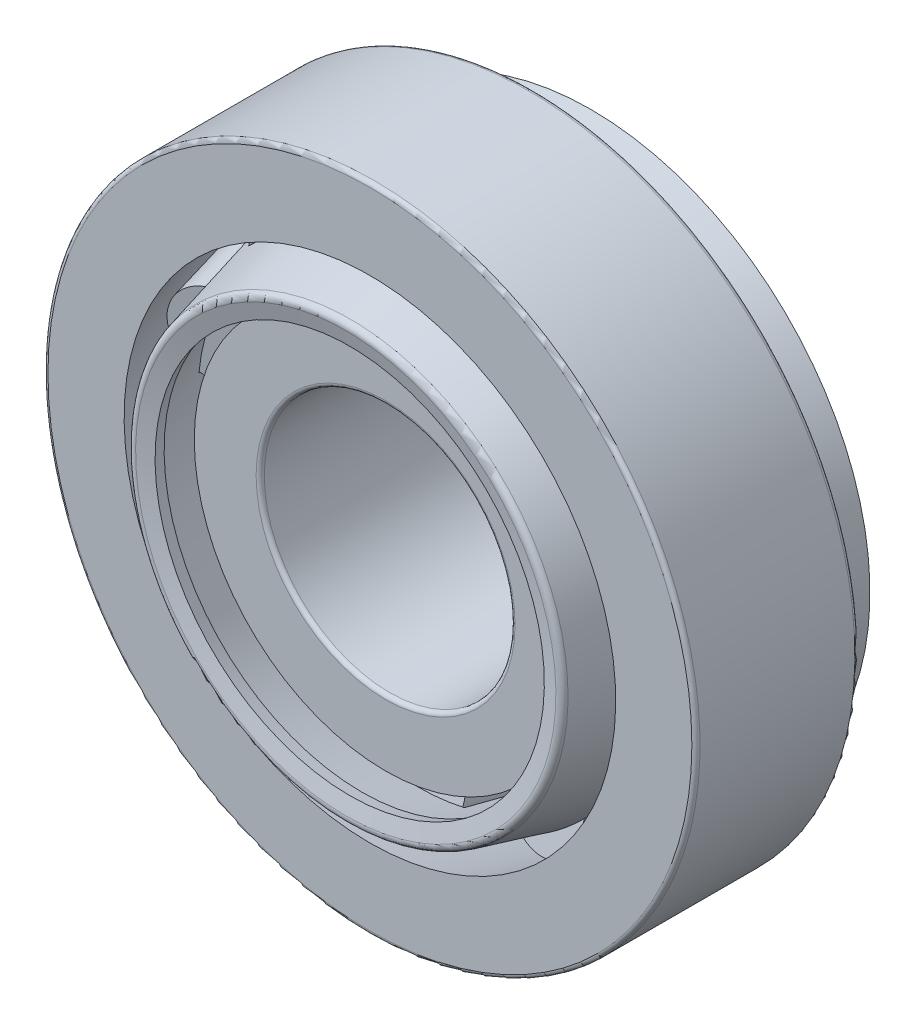
from build123d import *

# Parameters (mm, degrees)
SKETCH8_R           = 3.554681599
CUT_EXTRUDE1_DEPTH  = 9.171791
SKETCH10_R          = 3.427681599
BOSS_EXTRUDE1_DEPTH = 9.171791
CIRPATTERN1_COUNT   = 10
CIRPATTERN2_COUNT   = 10
FILLET1_R           = 0.325
FILLET2_R           = 0.325


with BuildPart() as part:
    # Sketch1 → Revolve1 (revolve)
    with BuildSketch(Plane(origin=(0, 0, 0), x_dir=(0, 0, -1), z_dir=(1, 0, 0)), mode=Mode.PRIVATE) as revolve1_sk:
        Polygon((-6.5, 26), (6.5, 26), (6.5, 22.908826187), (-6.5, 19.6), align=None)
    revolve(revolve1_sk.sketch.rotate(Axis((0, 0, 5.25), (0, 0, -1)), 180), axis=Axis((0, 0, 5.25), (0, 0, -1)))

    # Fillet1
    fillet1_edges = [part.edges().sort_by_distance(p)[0] for p in [
        (0, 26, -6.5),
        (0, 26, 6.5),
    ]]
    fillet(fillet1_edges, radius=FILLET1_R)


with BuildPart() as body_2:
    # Sketch5 → Revolve4 (revolve)
    with BuildSketch(Plane(origin=(0, 0, 0), x_dir=(0, 0, -1), z_dir=(1, 0, 0)), mode=Mode.PRIVATE) as revolve4_sk:
        Polygon((7.37680042, 15.79596116), (-1.51159979, 13.533640285), (-1.95, 15.256064615), (-5.25, 15.256064615), (-5.25, 10), (9.75, 10), (9.75, 17.51838549), (6.93840021, 17.51838549), align=None)
    revolve(revolve4_sk.sketch.rotate(Axis((0, 0, 5.25), (0, 0, -1)), 180), axis=Axis((0, 0, 5.25), (0, 0, -1)))

    # Fillet2
    fillet2_edges = [body_2.edges().sort_by_distance(p)[0] for p in [
        (0, 10, -9.75),
        (0, 10, 5.25),
    ]]
    fillet(fillet2_edges, radius=FILLET2_R)


with BuildPart() as body_3:
    # Sketch2 → Revolve2 (revolve)
    with BuildSketch(Plane(origin=(0, 0, 0), x_dir=(0, 0, -1), z_dir=(1, 0, 0)), mode=Mode.PRIVATE) as revolve2_sk:
        with BuildLine():
            Line((-8.426669626, 16.759664434), (-8.11159979, 15.521791049))
            Line((-8.11159979, 15.521791049), (-7.142497899, 15.768451797))
            Line((-7.142497899, 15.768451797), (-7.334237361, 16.521774235))
            Line((-7.334237361, 16.521774235), (11.369860328, 21.282436408))
            Line((11.369860328, 21.282436408), (11.12319958, 22.251538299))
            Line((11.12319958, 22.251538299), (-8.065449054, 17.367545753))
            ThreePointArc((-8.065449054, 17.367545753), (-8.371955684, 17.138416323), (-8.426669626, 16.759664434))
        make_face()
    revolve(revolve2_sk.sketch.rotate(Axis((0, 0, 5.25), (0, 0, -1)), 180), axis=Axis((0, 0, 5.25), (0, 0, -1)))

    # Sketch8 → Cut-Extrude1 (cut)
    with BuildSketch(Plane(origin=(0, 16.978488945, 2.38840021), x_dir=(1, 0, 0), z_dir=(0, -0.2466607473812321, 0.9691018912897301))):
        Circle(SKETCH8_R)
    cut_extrude1 = extrude(amount=-CUT_EXTRUDE1_DEPTH, mode=Mode.SUBTRACT)

    # CirPattern1: Cut-Extrude1 ×10 about axis
    cirpattern1_axis = Axis((0, 0, 0), (0, 0, 1))
    for i in range(1, CIRPATTERN1_COUNT):
        add(cut_extrude1.rotate(cirpattern1_axis, i * 360 / CIRPATTERN1_COUNT), mode=Mode.SUBTRACT)


with BuildPart() as body_4:
    # Sketch10 → Boss-Extrude1 (new body)
    with BuildSketch(Plane(origin=(0, 16.978488945, 2.38840021), x_dir=(1, 0, 0), z_dir=(0, -0.2466607473812321, 0.9691018912897301))):
        with Locations(Location((0, 0, 0), (0, 0, 270))):
            Circle(SKETCH10_R)
    extrude(amount=-BOSS_EXTRUDE1_DEPTH)


with BuildPart() as cirpattern2_1:
    # CirPattern2: pattern copy
    add(body_4.part.rotate(Axis((0, 0, 0), (0, 0, 1)), 1 * 360 / CIRPATTERN2_COUNT))


with BuildPart() as cirpattern2_2:
    # CirPattern2: pattern copy
    add(body_4.part.rotate(Axis((0, 0, 0), (0, 0, 1)), 2 * 360 / CIRPATTERN2_COUNT))


with BuildPart() as cirpattern2_3:
    # CirPattern2: pattern copy
    add(body_4.part.rotate(Axis((0, 0, 0), (0, 0, 1)), 3 * 360 / CIRPATTERN2_COUNT))


with BuildPart() as cirpattern2_4:
    # CirPattern2: pattern copy
    add(body_4.part.rotate(Axis((0, 0, 0), (0, 0, 1)), 4 * 360 / CIRPATTERN2_COUNT))


with BuildPart() as cirpattern2_5:
    # CirPattern2: pattern copy
    add(body_4.part.rotate(Axis((0, 0, 0), (0, 0, 1)), 5 * 360 / CIRPATTERN2_COUNT))


with BuildPart() as cirpattern2_6:
    # CirPattern2: pattern copy
    add(body_4.part.rotate(Axis((0, 0, 0), (0, 0, 1)), 6 * 360 / CIRPATTERN2_COUNT))


with BuildPart() as cirpattern2_7:
    # CirPattern2: pattern copy
    add(body_4.part.rotate(Axis((0, 0, 0), (0, 0, 1)), 7 * 360 / CIRPATTERN2_COUNT))


with BuildPart() as cirpattern2_8:
    # CirPattern2: pattern copy
    add(body_4.part.rotate(Axis((0, 0, 0), (0, 0, 1)), 8 * 360 / CIRPATTERN2_COUNT))


with BuildPart() as cirpattern2_9:
    # CirPattern2: pattern copy
    add(body_4.part.rotate(Axis((0, 0, 0), (0, 0, 1)), 9 * 360 / CIRPATTERN2_COUNT))


solid = Compound([part.part, body_2.part, body_3.part, body_4.part, cirpattern2_1.part, cirpattern2_2.part, cirpattern2_3.part, cirpattern2_4.part, cirpattern2_5.part, cirpattern2_6.part, cirpattern2_7.part, cirpattern2_8.part, cirpattern2_9.part])
